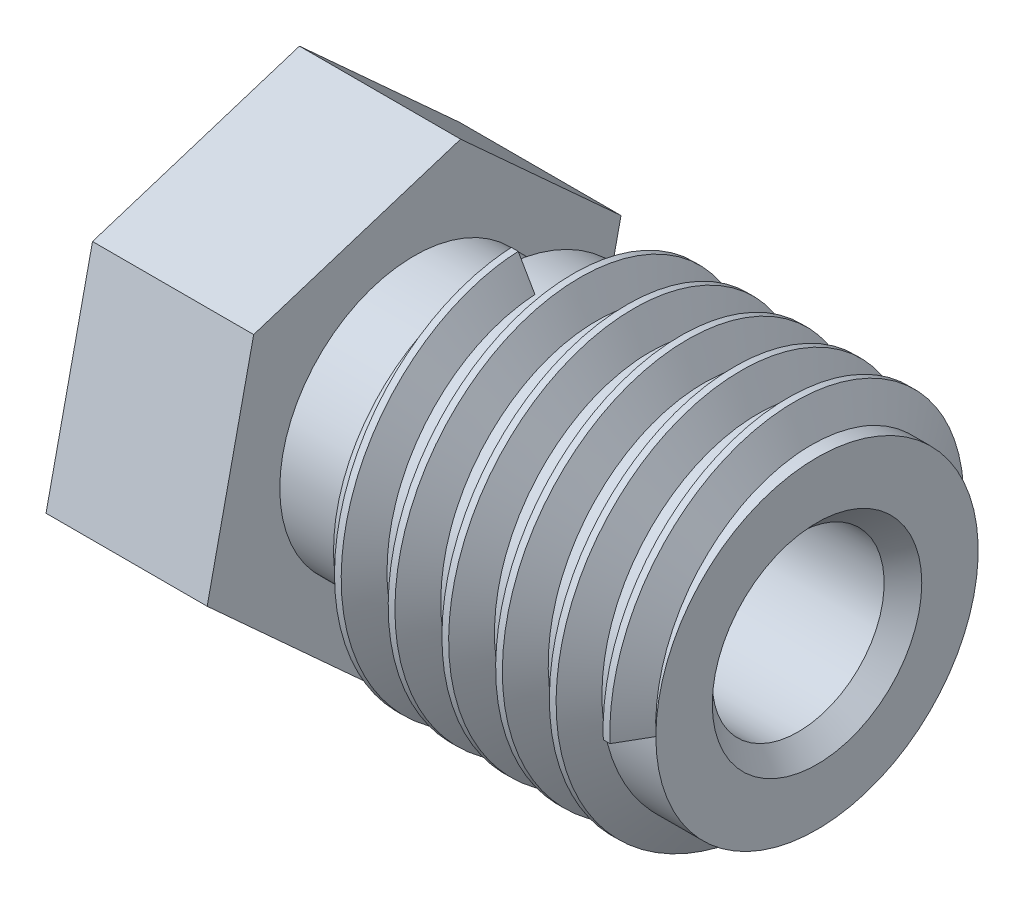
from build123d import *

# Parameters (mm, degrees)
BOSS_EXTRUDE1_DEPTH = 3
THREAD1_PITCH       = 1


with BuildPart() as part:
    # Sketch1 → Revolve1 (revolve)
    with BuildSketch(Plane.XY, mode=Mode.PRIVATE) as revolve1_sk:
        Polygon((2.658823529, 0.787753139), (2.658823529, 1.837753139), (-3.341176471, 1.837753139), (-3.341176471, 1.337753139), (-4.841176471, 1.337753139), (-4.841176471, 2.337753139), (-7.841176471, 2.337753139), (-7.841176471, 0.667753139), (-9.841176471, -0.486947399), (-9.841176471, -0.986947399), (-9.311176471, -0.986947399), (-6.843522753, 0.437753139), (2.308823529, 0.437753139), align=None)
    revolve(revolve1_sk.sketch.rotate(Axis((-10.075547593, -1.162246861, 0), (1, 0, 0)), 90), axis=Axis((-10.075547593, -1.162246861, 0), (1, 0, 0)))

    # Sketch2 → Boss-Extrude1 (add)
    with BuildSketch(Plane(origin=(-4.841176471, 0, 0), x_dir=(0, 0, -1), z_dir=(1, 0, 0))):
        Polygon((3.851630494, 0.061793935), (0.865764822, 2.785383391), (-2.985865672, 1.561342595), (-3.851630494, -2.386287657), (-0.865764822, -5.109877113), (2.985865672, -3.885836317), align=None)
    extrude(amount=-BOSS_EXTRUDE1_DEPTH)

    # Thread1: the profile of Thread Profile1 profile screwed along a right-hand helix of 5.25 turns, 8 arcs to a turn; built about Z, then put on its axis
    thread1_z = Axis((0, 0, 0), (0, 0, 1))
    thread1_corners = [(2.9997, 0, -0.000173205), (3.541265875, 0, 0.312499998), (3.541265875, 0, 0.437499998), (2.9997, 0, 0.750173202)]
    with BuildLine(mode=Mode.PRIVATE) as thread1_profile:
        Line(thread1_corners[0], thread1_corners[1])
        Line(thread1_corners[1], thread1_corners[2])
        Line(thread1_corners[2], thread1_corners[3])
        Line(thread1_corners[3], thread1_corners[0])
    thread1_cap = Face(thread1_profile.wire())
    thread1_turn_angles = [0, 22.5, 45, 67.5, 90, 112.5, 135, 157.5, 180, 202.5, 225, 247.5, 270, 292.5, 315, 337.5, 360]
    thread1_turn_weights = [1, 0.9238795325112867, 1, 0.9238795325112867, 1, 0.9238795325112867, 1, 0.9238795325112867, 1, 0.9238795325112867, 1, 0.9238795325112867, 1, 0.9238795325112867, 1, 0.9238795325112867, 1]
    thread1_turn_rails = [Edge.make_bspline([Vector(p[0], p[1], 0).rotate(thread1_z, thread1_turn_angles[k]) / thread1_turn_weights[k] + Vector(0, 0, p[2] + THREAD1_PITCH * thread1_turn_angles[k] / 360) for k in range(17)], [0, 0, 0, 1, 1, 2, 2, 3, 3, 4, 4, 5, 5, 6, 6, 7, 7, 8, 8, 8], 2, thread1_turn_weights) for p in thread1_corners]
    thread1_turn_sides = [Face.make_surface_from_curves(thread1_turn_rails[p[0]], thread1_turn_rails[p[1]]) for p in [(0, 1), (1, 2), (2, 3), (3, 0)]]
    thread1_last_angles = [1800, 1822.5, 1845, 1867.5, 1890]
    thread1_last_weights = [1, 0.9238795325112867, 1, 0.9238795325112867, 1]
    thread1_last_rails = [Edge.make_bspline([Vector(p[0], p[1], 0).rotate(thread1_z, thread1_last_angles[k]) / thread1_last_weights[k] + Vector(0, 0, p[2] + THREAD1_PITCH * thread1_last_angles[k] / 360) for k in range(5)], [0, 0, 0, 1, 1, 2, 2, 2], 2, thread1_last_weights) for p in thread1_corners]
    thread1_last_sides = [Face.make_surface_from_curves(thread1_last_rails[p[0]], thread1_last_rails[p[1]]) for p in [(0, 1), (1, 2), (2, 3), (3, 0)]]
    thread1 = Plane(origin=(2.658823529, -1.162246861, 0), x_dir=(0, 0, 1), z_dir=(-1, 0, 0)) * Solid(Shell([*[p.moved(Location((0, 0, THREAD1_PITCH * i))) for i in range(5) for p in thread1_turn_sides], *thread1_last_sides, thread1_cap, thread1_cap.rotate(thread1_z, 1890).moved(Location((0, 0, THREAD1_PITCH * 1890 / 360)))]))
    add(thread1)


solid = part.part
